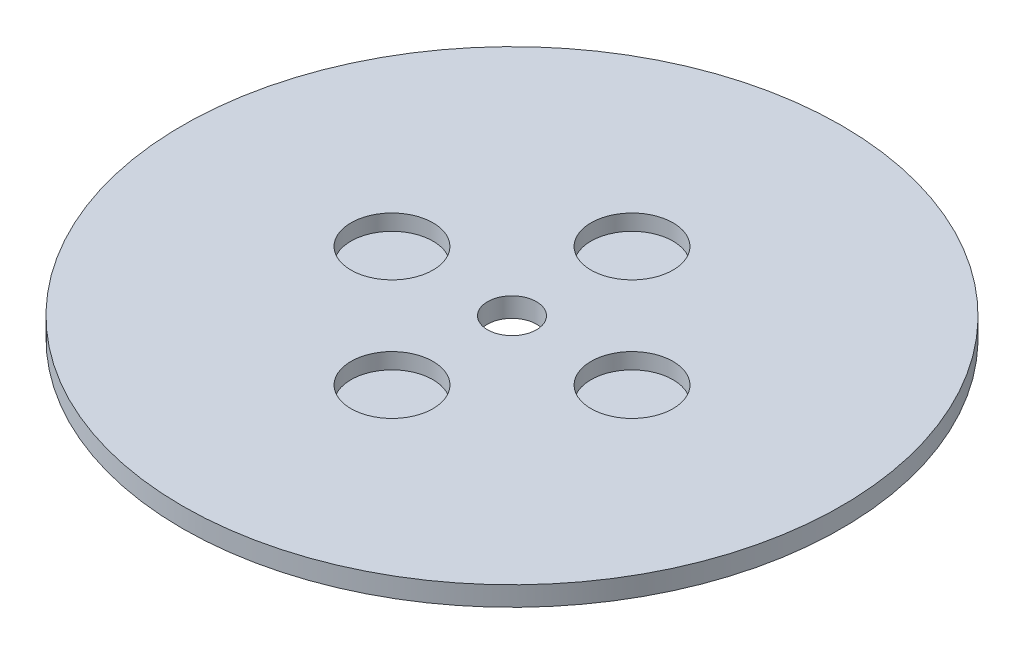
from build123d import *

# Parameters (mm, degrees)
SKETCH1_R           = 67.5
BOSS_EXTRUDE1_DEPTH = 4
SKETCH2_R           = 5
CUT_EXTRUDE1_DEPTH  = 96.543183954
SKETCH3_R           = 8.396657558
CUT_EXTRUDE2_DEPTH  = 3.251035198
CIRPATTERN1_COUNT   = 4


with BuildPart() as part:
    # Sketch1 → Boss-Extrude1 (new body)
    with BuildSketch(Plane(origin=(0, 0, 0), x_dir=(1, 0, 0), z_dir=(0, 1, 0))):
        Circle(SKETCH1_R)
    extrude(amount=BOSS_EXTRUDE1_DEPTH)

    # Sketch2 → Cut-Extrude1 (cut, through all)
    with BuildSketch(Plane(origin=(0, 0, 0), x_dir=(1, 0, 0), z_dir=(0, 1, 0))):
        Circle(SKETCH2_R)
    extrude(amount=CUT_EXTRUDE1_DEPTH, mode=Mode.SUBTRACT)

    # Sketch3 → Cut-Extrude2 (cut)
    with BuildSketch(Plane(origin=(0, 4, 0), x_dir=(1, 0, 0), z_dir=(0, 1, 0))):
        with Locations((-24.58160914, 0)):
            Circle(SKETCH3_R)
    cut_extrude2 = extrude(amount=-CUT_EXTRUDE2_DEPTH, mode=Mode.SUBTRACT)

    # CirPattern1: Cut-Extrude2 ×4 about axis
    cirpattern1_axis = Axis((0, 0, 0), (0, 1, 0))
    for i in range(1, CIRPATTERN1_COUNT):
        add(cut_extrude2.rotate(cirpattern1_axis, i * 360 / CIRPATTERN1_COUNT), mode=Mode.SUBTRACT)


solid = part.part
